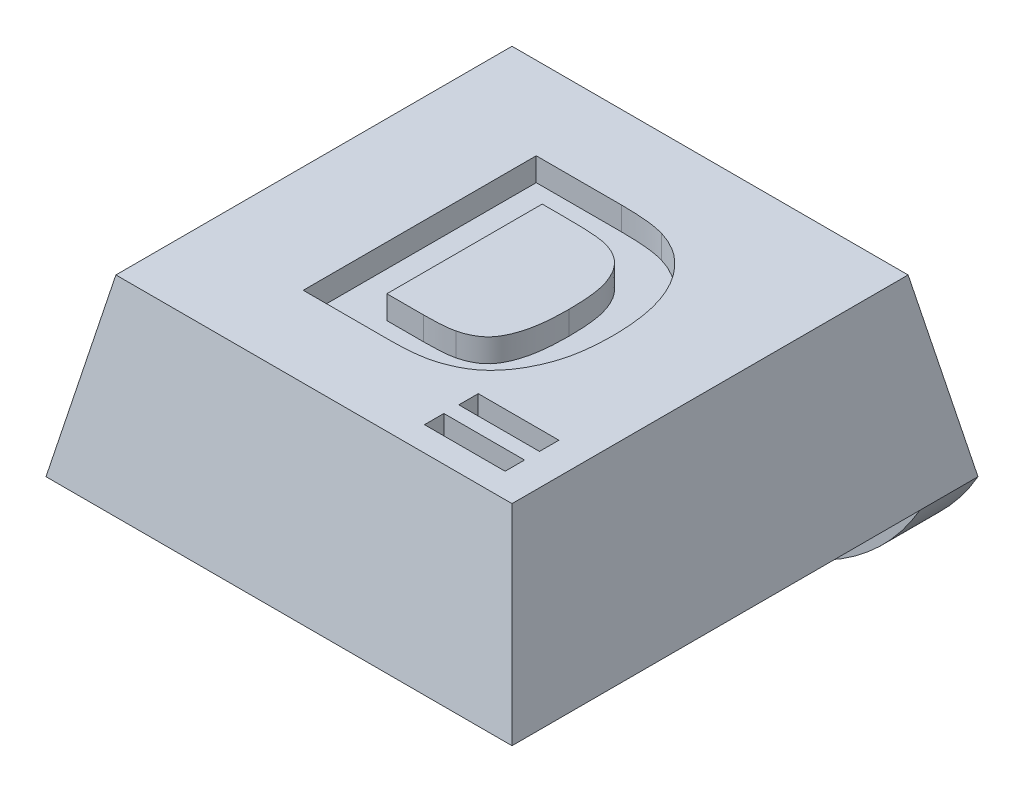
from build123d import *

# Parameters (mm, degrees)
SKETCH1_W               = 8
SKETCH1_H               = 8
BOSS_EXTRUDE1_DEPTH     = 3
CUT_EXTRUDE1_DEPTH      = 12.704699911
CUT_EXTRUDE1_DEPTH_BACK = 12.704699911
CUT_EXTRUDE2_DEPTH      = 11
SKETCH4_R               = 1.75
CUT_EXTRUDE3_DEPTH      = 0.4
SKETCH5_W               = 8
SKETCH5_H               = 1
BOSS_EXTRUDE2_DEPTH     = 2
FILLET1_R               = 4
CUT_EXTRUDE4_DEPTH      = 0.4
SKETCH7_W               = 1.384615385
SKETCH7_H               = 0.333333334
CUT_EXTRUDE5_DEPTH      = 0.55


with BuildPart() as part:
    # Sketch1 → Boss-Extrude1 (new body)
    with BuildSketch(Plane(origin=(0, 0, 0), x_dir=(1, 0, 0), z_dir=(0, 1, 0))):
        with Locations((4, 4)):
            Rectangle(SKETCH1_W, SKETCH1_H)
    extrude(amount=BOSS_EXTRUDE1_DEPTH)

    # Sketch2 → Cut-Extrude1 (cut, two sides: drawn at the far end of the back side and taken through both)
    with BuildSketch(Plane.XY.offset(-CUT_EXTRUDE1_DEPTH_BACK)):
        Polygon((0, 0), (0.6, 3), (0, 3), align=None)
        Polygon((8, 0), (7.4, 3), (8, 3), align=None)
    extrude(amount=CUT_EXTRUDE1_DEPTH + CUT_EXTRUDE1_DEPTH_BACK, mode=Mode.SUBTRACT)

    # Sketch3 → Cut-Extrude2 (cut)
    with BuildSketch(Plane(origin=(0, 0, 0), x_dir=(0, 0, -1), z_dir=(1, 0, 0))):
        Polygon((0, 0), (0.6, 3), (0, 3), align=None)
        Polygon((8, 3), (7.4, 3), (8, 0), align=None)
    extrude(amount=CUT_EXTRUDE2_DEPTH, mode=Mode.SUBTRACT)

    # Sketch4 → Cut-Extrude3 (cut)
    with BuildSketch(Plane.XZ):
        with Locations(Location((4, -3.75, 0), (0, 0, 270))):
            Circle(SKETCH4_R)
    extrude(amount=-CUT_EXTRUDE3_DEPTH, mode=Mode.SUBTRACT)

    # Sketch5 → Boss-Extrude2 (add)
    with BuildSketch(Plane.XZ):
        with Locations((4, -7.5)):
            Rectangle(SKETCH5_W, SKETCH5_H)
    extrude(amount=BOSS_EXTRUDE2_DEPTH)

    # Fillet1
    # the kernel refuses this fillet: 4 mm, written as the material it takes off along each edge
    with BuildSketch(Plane(origin=(8, -2, -16.660254038), x_dir=(0, 1, 0), z_dir=(0, 0, 1)), Plane(origin=(0, -2, 1.660254038), x_dir=(0, 1, 0), z_dir=(0, 0, -1))) as fillet1_piece_1:
        with BuildLine():
            CenterArc((4, 3.464101615), FILLET1_R, 180, 60)
            Line((0, 3.464101615), (-0.08, 3.464101615))
            Line((-0.08, 3.464101615), (-0.08, 0))
            Line((-0.08, 0), (0, -0.08))
            ThreePointArc((0, -0.08), (1, -0.08), (1.96, -0.069282032))
            Line((1.96, -0.069282032), (2, 0))
        make_face()
    extrude(amount=18.320508076, mode=Mode.SUBTRACT)

    # Sketch6 → Cut-Extrude4 (cut)
    with BuildSketch(Plane(origin=(0, 3, 0), x_dir=(1, 0, 0), z_dir=(0, 1, 0))):
        with BuildLine():
            Line((2.436272881, 5.979723732), (3.903420317, 5.979723732))
            add(Edge.make_bspline(
                [(3.903420317, 5.979723732), (3.943490496, 5.979744505), (4.021516441, 5.979784954), (4.134752515, 5.975087302), (4.240642802, 5.970362082), (4.338883372, 5.960903224), (4.429815049, 5.950988663), (4.51360101, 5.938436084), (4.589711972, 5.922348579), (4.637707501, 5.909661658), (4.660631856, 5.903601937)],
                knots=[0, 0, 0, 0, 1.259756885, 2.453039283, 3.563158368, 4.591894114, 5.55549294, 6.43918076, 7.254497783, 8, 8, 8, 8], degree=3))
            add(Edge.make_bspline(
                [(4.660631856, 5.903601937), (4.689300162, 5.894258489), (4.74612039, 5.87573989), (4.829420592, 5.843292221), (4.908343197, 5.803050568), (4.985816138, 5.760749105), (5.058380803, 5.710732544), (5.129877456, 5.658697008), (5.195666079, 5.598419283), (5.281939397, 5.514177193), (5.380383811, 5.396825298), (5.483519335, 5.241163905), (5.570813292, 5.070304112), (5.630456537, 4.917219685), (5.670729972, 4.787084992), (5.697056277, 4.682749965), (5.719418871, 4.572846322), (5.737778631, 4.457346355), (5.752043635, 4.336250048), (5.762664083, 4.209589679), (5.767837312, 4.07725583), (5.769008616, 3.987205692), (5.769606215, 3.941262194)],
                knots=[0, 0, 0, 0, 0.745524535, 1.477620414, 2.207090574, 2.934465325, 3.657932502, 4.384347339, 5.118673636, 5.861150177, 7.365375624, 8.894729774, 10.468936425, 12.099947606, 12.950091786, 13.83580991, 14.759228729, 15.722225242, 16.726454549, 17.773376212, 18.863978586, 20, 20, 20, 20], degree=3))
            add(Edge.make_bspline(
                [(5.769606215, 3.941262194), (5.768515323, 3.861857727), (5.766405561, 3.708291084), (5.741963835, 3.486695058), (5.70674022, 3.280872561), (5.667035899, 3.152471539), (5.647811343, 3.090300655)],
                knots=[0, 0, 0, 0, 1.103207939, 2.133582005, 3.096293362, 4, 4, 4, 4], degree=3))
            add(Edge.make_bspline(
                [(5.647811343, 3.090300655), (5.635116766, 3.054625647), (5.610144552, 2.98444734), (5.566445051, 2.883214788), (5.519227431, 2.786877042), (5.468100041, 2.695510004), (5.412804571, 2.609524646), (5.353134197, 2.529178156), (5.290013855, 2.453412746), (5.244286819, 2.406778778), (5.221529292, 2.383569886)],
                knots=[0, 0, 0, 0, 1.090884612, 2.145940218, 3.175104604, 4.181306866, 5.161203701, 6.118658341, 7.063689906, 8, 8, 8, 8], degree=3))
            add(Edge.make_bspline(
                [(5.221529292, 2.383569886), (5.184702113, 2.350450915), (5.108759222, 2.282154876), (4.974934842, 2.197635799), (4.823675662, 2.122952418), (4.714264019, 2.084588805), (4.657426727, 2.06465963)],
                knots=[0, 0, 0, 0, 0.908140292, 1.872714733, 2.8949153, 4, 4, 4, 4], degree=3))
            add(Edge.make_bspline(
                [(4.657426727, 2.06465963), (4.634546833, 2.057632533), (4.587060796, 2.043048157), (4.511767003, 2.027471741), (4.431388989, 2.011061834), (4.344999886, 2.001176252), (4.253496453, 1.990751469), (4.156149493, 1.984898536), (4.053296456, 1.980743294), (3.98275208, 1.980068625), (3.946689548, 1.979723732)],
                knots=[0, 0, 0, 0, 0.799129865, 1.658552685, 2.566799617, 3.538529252, 4.561352959, 5.643373779, 6.795284424, 8, 8, 8, 8], degree=3))
            Line((3.946689548, 1.979723732), (2.436272881, 1.979723732))
            Line((2.436272881, 1.979723732), (2.436272881, 5.979723732))
        make_face()
        with BuildLine():
            Line((3.205503651, 5.313057065), (3.205503651, 2.646390399))
            Line((3.205503651, 2.646390399), (3.838516471, 2.646390399))
            add(Edge.make_bspline(
                [(3.838516471, 2.646390399), (3.86709534, 2.646617049), (3.922120581, 2.647053436), (4.001743514, 2.648335709), (4.07491632, 2.651807064), (4.142022322, 2.655402822), (4.202886818, 2.661343643), (4.257774639, 2.667186667), (4.306380252, 2.675360935), (4.336400272, 2.681813595), (4.350535702, 2.684851937)],
                knots=[0, 0, 0, 0, 1.333384787, 2.567275092, 3.714769766, 4.750907381, 5.701951617, 6.567520054, 7.325492842, 8, 8, 8, 8], degree=3))
            add(Edge.make_bspline(
                [(4.350535702, 2.684851937), (4.38364248, 2.693686468), (4.44812575, 2.710893803), (4.538666782, 2.749253907), (4.62059475, 2.795531175), (4.695281698, 2.8511776), (4.762590099, 2.92150181), (4.820046047, 3.011440962), (4.873220012, 3.118706088), (4.909633556, 3.221385639), (4.935771128, 3.313096613), (4.95346412, 3.390071897), (4.967446413, 3.47335137), (4.979473009, 3.562606359), (4.989190784, 3.657722085), (4.995237644, 3.759042029), (4.999364663, 3.866442163), (5.000032135, 3.940189623), (5.000375445, 3.978121168)],
                knots=[0, 0, 0, 0, 1.038686998, 2.023088296, 2.974059649, 3.888265163, 4.839857954, 5.909819677, 7.113156087, 8.466843969, 9.20827164, 10.006482943, 10.861893492, 11.769681931, 12.739021491, 13.762258324, 14.849031541, 16, 16, 16, 16], degree=3))
            add(Edge.make_bspline(
                [(5.000375445, 3.978121168), (5.000034775, 4.01605283), (4.999374834, 4.089533605), (4.995254144, 4.196132914), (4.989241251, 4.29585735), (4.979454269, 4.38883019), (4.967614104, 4.475179926), (4.953468032, 4.554979633), (4.935881696, 4.627705609), (4.909721893, 4.71410541), (4.870064977, 4.811221472), (4.816099655, 4.917402921), (4.749828382, 5.00790436), (4.676605078, 5.08652444), (4.592177372, 5.151224792), (4.498716105, 5.205415106), (4.394186359, 5.247475499), (4.319831067, 5.2653904), (4.281625445, 5.274595527)],
                knots=[0, 0, 0, 0, 1.117996097, 2.165769068, 3.143980016, 4.062055362, 4.920439205, 5.712587309, 6.449616741, 7.124491204, 8.371470382, 9.537068822, 10.625202851, 11.666538334, 12.693249444, 13.747832046, 14.842779399, 16, 16, 16, 16], degree=3))
            add(Edge.make_bspline(
                [(4.281625445, 5.274595527), (4.265088191, 5.27766838), (4.228679487, 5.284433627), (4.168262747, 5.292335475), (4.097380449, 5.298199321), (4.015671249, 5.304185793), (3.923465993, 5.307602683), (3.820378875, 5.311168762), (3.706841263, 5.312386928), (3.627511913, 5.312827267), (3.586112625, 5.313057065)],
                knots=[0, 0, 0, 0, 0.578738571, 1.274160813, 2.095454135, 3.025967819, 4.093109015, 5.270126069, 6.575371698, 8, 8, 8, 8], degree=3))
            Line((3.586112625, 5.313057065), (3.205503651, 5.313057065))
        make_face(mode=Mode.SUBTRACT)
    extrude(amount=-CUT_EXTRUDE4_DEPTH, mode=Mode.SUBTRACT)

    # Sketch7 → Cut-Extrude5 (cut)
    with BuildSketch(Plane(origin=(0, 3, 0), x_dir=(1, 0, 0), z_dir=(0, 1, 0))):
        with Locations((6.167407218, 1.778686134)):
            Rectangle(SKETCH7_W, SKETCH7_H)
        with Locations((6.167407218, 1.188942544)):
            Rectangle(SKETCH7_W, SKETCH7_H)
    extrude(amount=-CUT_EXTRUDE5_DEPTH, mode=Mode.SUBTRACT)


solid = part.part
